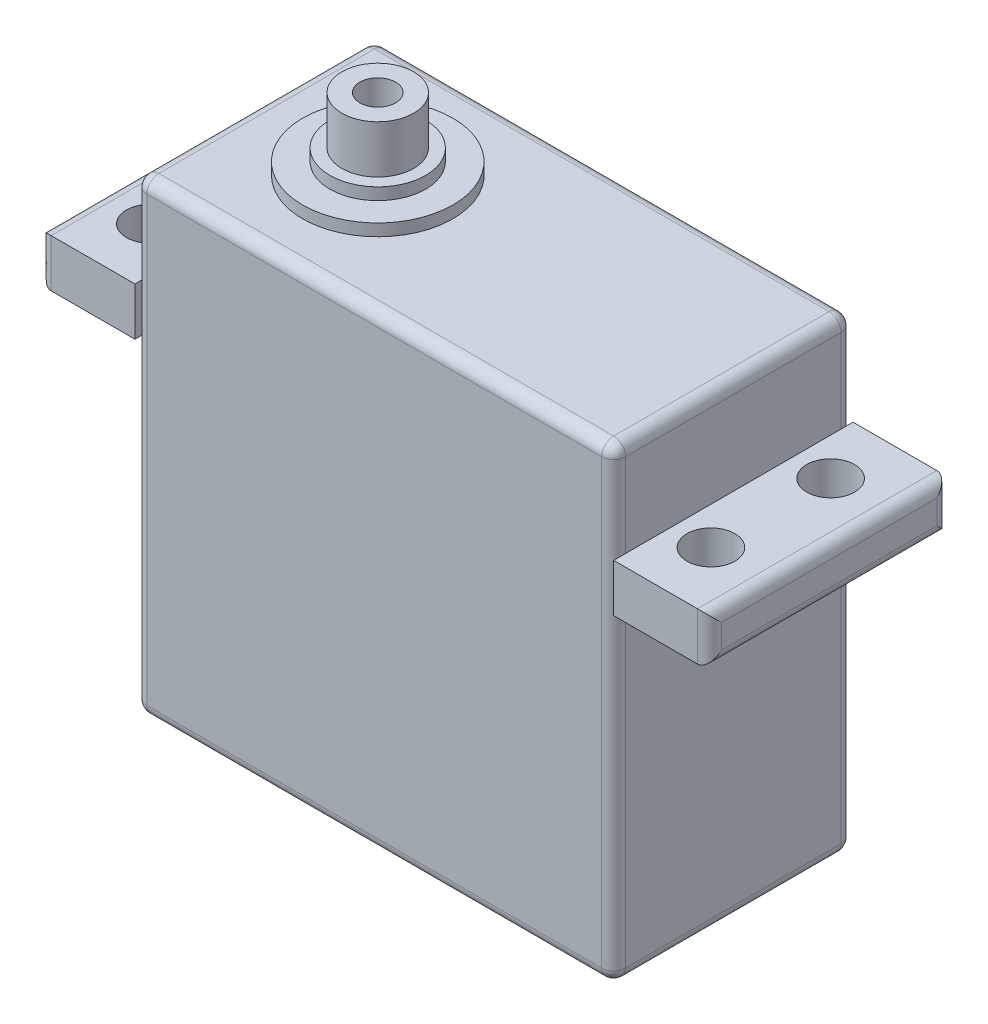
from build123d import *

# Parameters (mm, degrees)
SKETCH_1_W          = 40
SKETCH_1_H          = 39
EXTRUDE_1_DEPTH     = 20
FILLET_1_R          = 1
SKETCH_2_W          = 20
SKETCH_2_H          = 4
EXTRUDE_2_DEPTH     = 8
FILLET_4_R          = 1
SKETCH_3_W          = 20
SKETCH_3_H          = 4
EXTRUDE_3_DEPTH     = 8
FILLET_5_R          = 1
SKETCH_5_R          = 2
CUT_EXTRUDE_2_DEPTH = 4
SKETCH_13_R         = 2
CUT_EXTRUDE_3_DEPTH = 4
SKETCH_17_R         = 3
EXTRUDE_8_DEPTH     = 6
SKETCH_21_R         = 6.282177793
SKETCH_21_R_2       = 4
EXTRUDE_9_DEPTH     = 1
SKETCH_22_R         = 4
EXTRUDE_10_DEPTH    = 2
SKETCH_28_R         = 1.5
CUT_EXTRUDE_4_DEPTH = 6


with BuildPart() as part:
    # 草图1 → 凸台-拉伸1 (new body)
    with BuildSketch(Plane.XY):
        Rectangle(SKETCH_1_W, SKETCH_1_H)
    extrude(amount=EXTRUDE_1_DEPTH)

    # 圆角1
    fillet_1_edges = [part.edges().sort_by_distance(p)[0] for p in [
        (-20, 0, 0),
        (-20, -19.5, 10),
        (0, -19.5, 0),
        (20, -19.5, 10),
        (20, 0, 0),
        (20, 19.5, 10),
        (-20, 19.5, 10),
        (0, 19.5, 0),
        (0, -19.5, 20),
        (-20, 0, 20),
        (0, 19.5, 20),
        (20, 0, 20),
    ]]
    fillet(fillet_1_edges, radius=FILLET_1_R)

    # 草图2 → 凸台-拉伸2 (add)
    with BuildSketch(Plane(origin=(20, 0, 0), x_dir=(0, 0, -1), z_dir=(1, 0, 0))):
        with Locations((-10, 9.5)):
            Rectangle(SKETCH_2_W, SKETCH_2_H)
    extrude(amount=EXTRUDE_2_DEPTH)

    # 圆角4
    fillet_4_edges = [part.edges().sort_by_distance(p)[0] for p in [
        (28, 9.5, 20),
        (28, 11.5, 10),
        (28, 9.5, 0),
        (28, 7.5, 10),
    ]]
    fillet(fillet_4_edges, radius=FILLET_4_R)

    # 草图3 → 凸台-拉伸3 (add)
    with BuildSketch(Plane.ZY.offset(20)):
        with Locations((10, 9.5)):
            Rectangle(SKETCH_3_W, SKETCH_3_H)
    extrude(amount=EXTRUDE_3_DEPTH)

    # 圆角5
    fillet_5_edges = [part.edges().sort_by_distance(p)[0] for p in [
        (-28, 9.5, 0),
        (-28, 11.5, 10),
        (-28, 9.5, 20),
        (-28, 7.5, 10),
    ]]
    fillet(fillet_5_edges, radius=FILLET_5_R)

    # 草图5 → 切除-拉伸2 (cut)
    with BuildSketch(Plane(origin=(0, 11.5, 0), x_dir=(1, 0, 0), z_dir=(0, 1, 0))):
        with Locations((-23.712418919, -15)):
            Circle(SKETCH_5_R)
        with Locations((-23.712418919, -5)):
            Circle(SKETCH_5_R)
    extrude(amount=-CUT_EXTRUDE_2_DEPTH, mode=Mode.SUBTRACT)

    # 草图13 → 切除-拉伸3 (cut)
    with BuildSketch(Plane(origin=(0, 11.5, 0), x_dir=(1, 0, 0), z_dir=(0, 1, 0))):
        with Locations((23.126022161, -5)):
            Circle(SKETCH_13_R)
        with Locations((23.126022161, -15)):
            Circle(SKETCH_13_R)
    extrude(amount=-CUT_EXTRUDE_3_DEPTH, mode=Mode.SUBTRACT)

    # 草图17 → 凸台-拉伸8 (add)
    with BuildSketch(Plane(origin=(0, 19.5, 0), x_dir=(1, 0, 0), z_dir=(0, 1, 0))):
        with Locations((-9.712418919, -10)):
            Circle(SKETCH_17_R)
    extrude(amount=EXTRUDE_8_DEPTH)

    # 草图21 → 凸台-拉伸9 (add)
    with BuildSketch(Plane(origin=(0, 19.5, 0), x_dir=(1, 0, 0), z_dir=(0, 1, 0))):
        with Locations((-9.712418919, -10)):
            Circle(SKETCH_21_R)
        with Locations((-9.712418919, -10)):
            Circle(SKETCH_21_R_2, mode=Mode.SUBTRACT)
    extrude(amount=EXTRUDE_9_DEPTH)

    # 草图22 → 凸台-拉伸10 (add)
    with BuildSketch(Plane(origin=(0, 19.5, 0), x_dir=(1, 0, 0), z_dir=(0, 1, 0))):
        with Locations((-9.712418919, -10)):
            Circle(SKETCH_22_R)
    extrude(amount=EXTRUDE_10_DEPTH)

    # 草图28 → 切除-拉伸4 (cut)
    with BuildSketch(Plane(origin=(0, 25.5, 0), x_dir=(1, 0, 0), z_dir=(0, 1, 0))):
        with Locations((-9.712418919, -10)):
            Circle(SKETCH_28_R)
    extrude(amount=-CUT_EXTRUDE_4_DEPTH, mode=Mode.SUBTRACT)


solid = part.part
